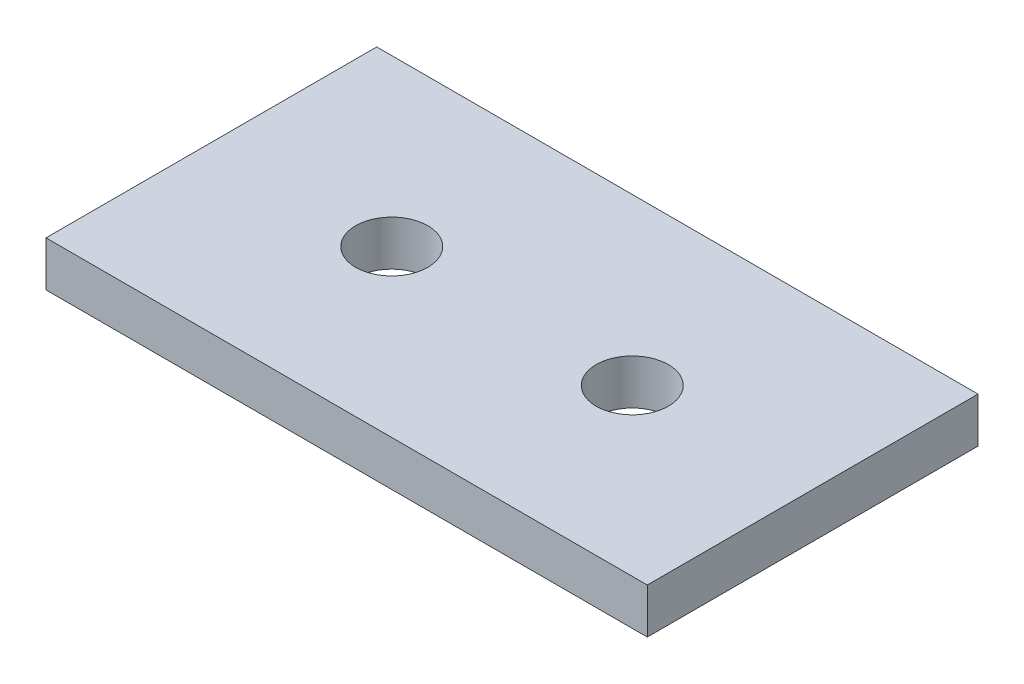
from build123d import *

# Parameters (mm, degrees)
SKETCH1_W           = 20
SKETCH1_H           = 11
BOSS_EXTRUDE1_DEPTH = 1.5
SKETCH2_R           = 1.2
CUT_EXTRUDE1_DEPTH  = 1.5


with BuildPart() as part:
    # Sketch1 → Boss-Extrude1 (new body)
    with BuildSketch(Plane(origin=(0, 0, 0), x_dir=(1, 0, 0), z_dir=(0, 1, 0))):
        with Locations((-10, 0)):
            Rectangle(SKETCH1_W, SKETCH1_H)
    extrude(amount=-BOSS_EXTRUDE1_DEPTH)

    # Sketch2 → Cut-Extrude1 (cut)
    with BuildSketch(Plane(origin=(0, 0, 0), x_dir=(1, 0, 0), z_dir=(0, 1, 0))):
        with Locations((-6, 0)):
            Circle(SKETCH2_R)
        with Locations((-14, 0)):
            Circle(SKETCH2_R)
    extrude(amount=-CUT_EXTRUDE1_DEPTH, mode=Mode.SUBTRACT)


solid = part.part
